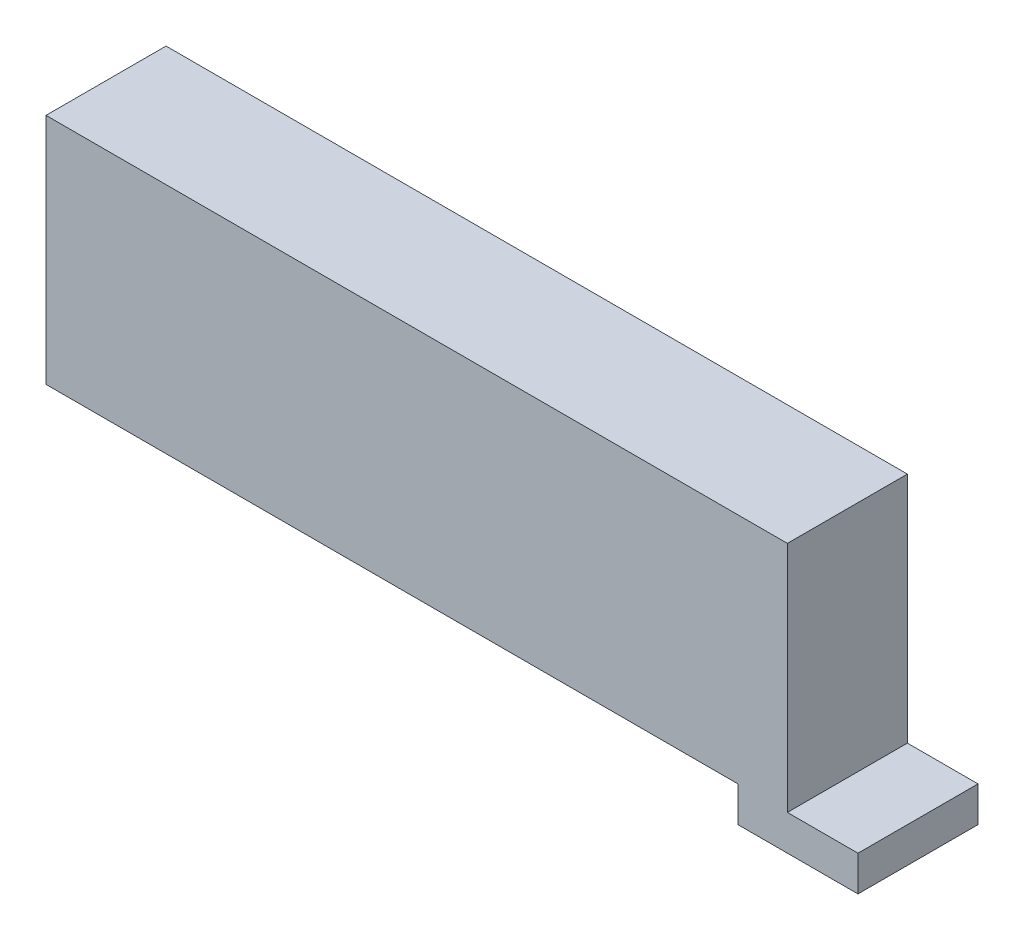
from build123d import *

# Parameters (mm, degrees)
SKETCH1_W           = 105
SKETCH1_H           = 33
BOSS_EXTRUDE1_DEPTH = 17
SKETCH2_W           = 7
SKETCH2_H           = 17
BOSS_EXTRUDE2_DEPTH = 5
SKETCH3_W           = 17
SKETCH3_H           = 5
BOSS_EXTRUDE3_DEPTH = 10


with BuildPart() as part:
    # Sketch1 → Boss-Extrude1 (new body)
    with BuildSketch(Plane.XY):
        Rectangle(SKETCH1_W, SKETCH1_H)
    extrude(amount=BOSS_EXTRUDE1_DEPTH)

    # Sketch2 → Boss-Extrude2 (add)
    with BuildSketch(Plane.XZ.offset(16.5)):
        with Locations((49, 8.5)):
            Rectangle(SKETCH2_W, SKETCH2_H)
    extrude(amount=BOSS_EXTRUDE2_DEPTH)

    # Sketch3 → Boss-Extrude3 (add)
    with BuildSketch(Plane(origin=(52.5, 0, 0), x_dir=(0, 0, -1), z_dir=(1, 0, 0))):
        with Locations((-8.5, -19)):
            Rectangle(SKETCH3_W, SKETCH3_H)
    extrude(amount=BOSS_EXTRUDE3_DEPTH)


solid = part.part
